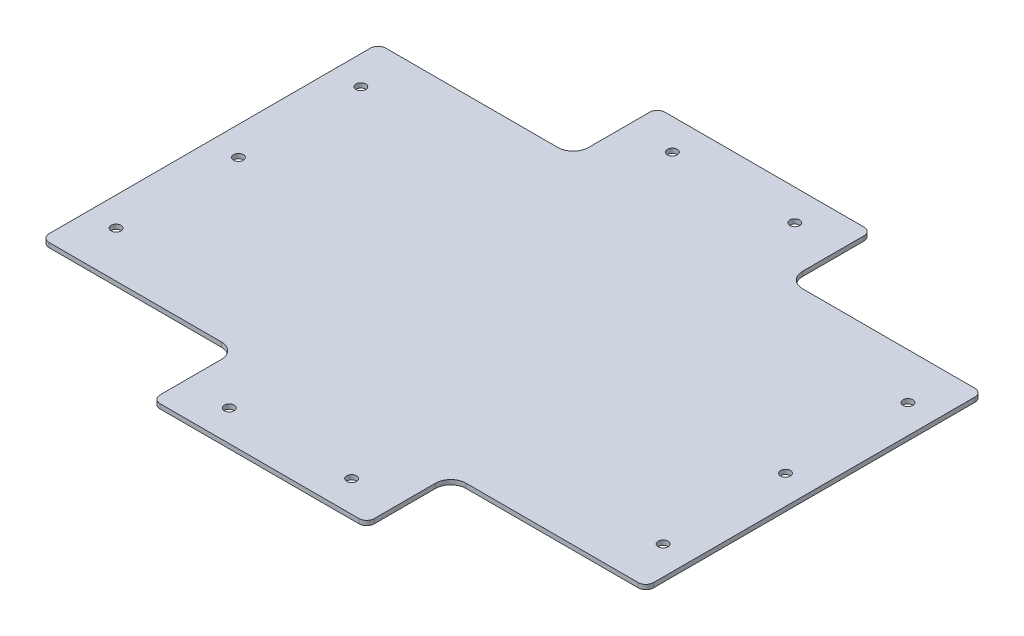
from build123d import *

# Parameters (mm, degrees)
SKETCH_1_R      = 3.2
EXTRUDE_1_DEPTH = 3


with BuildPart() as part:
    # Эскиз1 → Бобышка-Вытянуть1 (new body)
    with BuildSketch(Plane(origin=(0, 0, 0), x_dir=(1, 0, 0), z_dir=(0, 1, 0))):
        with BuildLine():
            ThreePointArc((-70, -160), (-68.535533906, -163.535533906), (-65, -165))
            Line((-65, -165), (65, -165))
            ThreePointArc((65, -165), (68.535533906, -163.535533906), (70, -160))
            Line((70, -160), (70, -120))
            ThreePointArc((70, -120), (72.928932188, -112.928932188), (80, -110))
            Line((80, -110), (192.5, -110))
            ThreePointArc((192.5, -110), (196.035533906, -108.535533906), (197.5, -105))
            Line((197.5, -105), (197.5, 105))
            ThreePointArc((197.5, 105), (196.035533906, 108.535533906), (192.5, 110))
            Line((192.5, 110), (80, 110))
            ThreePointArc((80, 110), (72.928932188, 112.928932188), (70, 120))
            Line((70, 120), (70, 160))
            ThreePointArc((70, 160), (68.535533906, 163.535533906), (65, 165))
            Line((65, 165), (-65, 165))
            ThreePointArc((-65, 165), (-68.535533906, 163.535533906), (-70, 160))
            Line((-70, 160), (-70, 120))
            ThreePointArc((-70, 120), (-72.928932188, 112.928932188), (-80, 110))
            Line((-80, 110), (-192.5, 110))
            ThreePointArc((-192.5, 110), (-196.035533906, 108.535533906), (-197.5, 105))
            Line((-197.5, 105), (-197.5, -105))
            ThreePointArc((-197.5, -105), (-196.035533906, -108.535533906), (-192.5, -110))
            Line((-192.5, -110), (-80, -110))
            ThreePointArc((-80, -110), (-72.928932188, -112.928932188), (-70, -120))
            Line((-70, -120), (-70, -160))
        make_face()
        with Locations((-40, -144.805454142)):
            Circle(SKETCH_1_R, mode=Mode.SUBTRACT)
        with Locations((40, -144.805454142)):
            Circle(SKETCH_1_R, mode=Mode.SUBTRACT)
        with Locations((-40, 144.805454142)):
            Circle(SKETCH_1_R, mode=Mode.SUBTRACT)
        with Locations((40, 144.805454142)):
            Circle(SKETCH_1_R, mode=Mode.SUBTRACT)
        with Locations((-178.768667216, 0)):
            Circle(SKETCH_1_R, mode=Mode.SUBTRACT)
        with Locations((-178.768667216, 80)):
            Circle(SKETCH_1_R, mode=Mode.SUBTRACT)
        with Locations((-178.768667216, -80)):
            Circle(SKETCH_1_R, mode=Mode.SUBTRACT)
        with Locations((178.768667216, 0)):
            Circle(SKETCH_1_R, mode=Mode.SUBTRACT)
        with Locations((178.768667216, 80)):
            Circle(SKETCH_1_R, mode=Mode.SUBTRACT)
        with Locations((178.768667216, -80)):
            Circle(SKETCH_1_R, mode=Mode.SUBTRACT)
    extrude(amount=EXTRUDE_1_DEPTH)


solid = part.part
